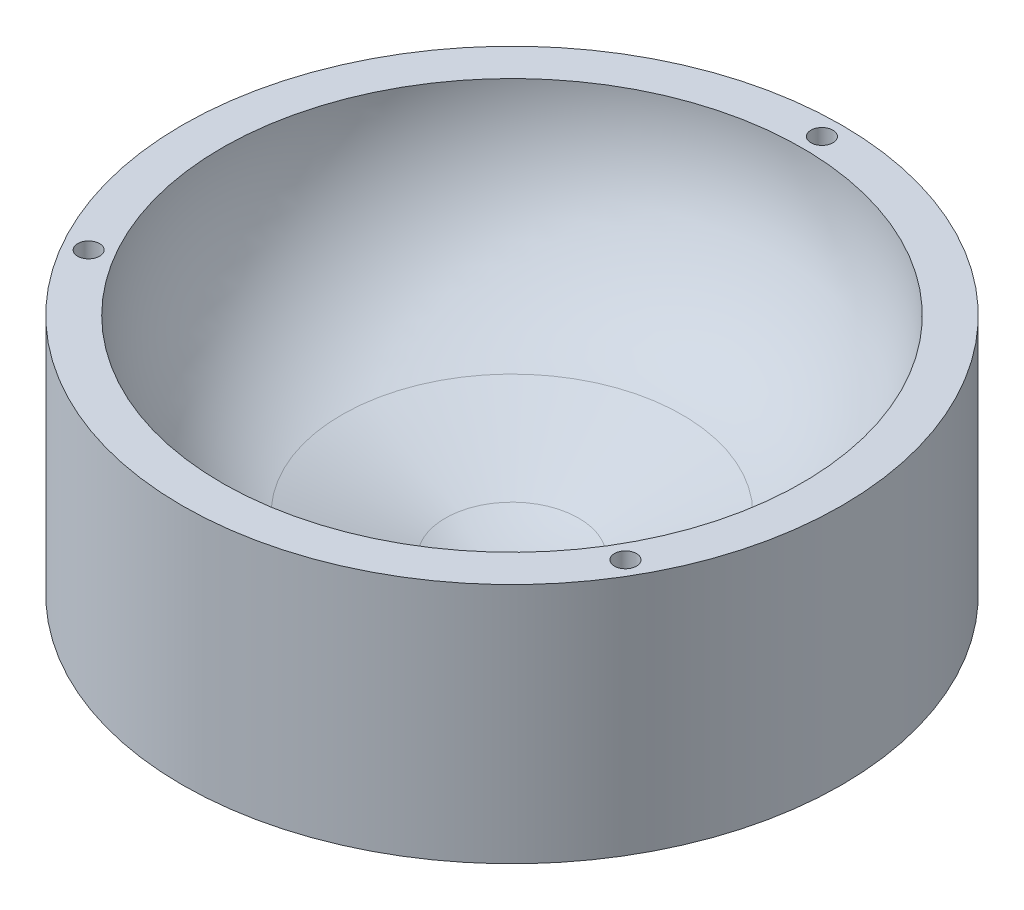
from build123d import *

# Parameters (mm, degrees)
SKETCH1_R           = 95.25
BOSS_EXTRUDE1_DEPTH = 34.925
SKETCH8_R           = 3.175
CUT_EXTRUDE1_DEPTH  = 69.85
CIRPATTERN1_COUNT   = 3
CUT_EXTRUDE2_START  = -34.925
SKETCH12_R          = 3.175
CUT_EXTRUDE2_DEPTH  = 63.5
CIRPATTERN2_COUNT   = 3


# Read off the part's stored shape, not the designer's step: Cavity1
with BuildPart() as part:
    # Sketch1 → Boss-Extrude1 (new, symmetric)
    with BuildSketch(Plane(origin=(0, 0, 0), x_dir=(1, 0, 0), z_dir=(0, 1, 0))):
        with Locations(Location((0, 0, 0), (0, 0, 270))):
            Circle(SKETCH1_R)
    extrude(amount=BOSS_EXTRUDE1_DEPTH, both=True)

    # Cavity1 outline → Cavity1 (revolve, cut)
    with BuildSketch(Plane.XY):
        with BuildLine():
            Line((0, 34.925), (0, -28.752211277))
            Line((0, -28.752211277), (0.381787731, -28.752211277))
            ThreePointArc((0.381787731, -28.752211277), (9.972417265, -27.913139917), (19.271640373, -25.421420595))
            Line((19.271640373, -25.421420595), (49.189756576, -14.532116831))
            ThreePointArc((49.189756576, -14.532116831), (74.301764107, 4.737004269), (83.820002599, 34.925))
            Line((83.820002599, 34.925), (0, 34.925))
        make_face()
    revolve(axis=Axis((0, 0, 0), (0, 1, 0)), mode=Mode.SUBTRACT)

    # Sketch8 → Cut-Extrude1 (cut)
    with BuildSketch(Plane(origin=(0, 34.925, 0), x_dir=(1, 0, 0), z_dir=(0, 1, 0))):
        with Locations(Location((0, 89.535, 0), (0, 0, 270))):
            Circle(SKETCH8_R)
    cut_extrude1 = extrude(amount=-CUT_EXTRUDE1_DEPTH, mode=Mode.SUBTRACT)

    # CirPattern1: Cut-Extrude1 ×3 about axis
    cirpattern1_axis = Axis((0, 0, 0), (0, 1, 0))
    for i in range(1, CIRPATTERN1_COUNT):
        add(cut_extrude1.rotate(cirpattern1_axis, i * 360 / CIRPATTERN1_COUNT), mode=Mode.SUBTRACT)

    # Sketch12 → Cut-Extrude2 (cut)
    with BuildSketch(Plane(origin=(0, 34.925, 0), x_dir=(1, 0, 0), z_dir=(0, 1, 0)).offset(CUT_EXTRUDE2_START)):
        with Locations(Location((77.539584528, 44.7675, 0), (0, 0, 270))):
            Circle(SKETCH12_R)
    cut_extrude2 = extrude(amount=-CUT_EXTRUDE2_DEPTH, mode=Mode.SUBTRACT)

    # CirPattern2: Cut-Extrude2 ×3 about axis
    cirpattern2_axis = Axis((0, 0, 0), (0, 1, 0))
    for i in range(1, CIRPATTERN2_COUNT):
        add(cut_extrude2.rotate(cirpattern2_axis, i * 360 / CIRPATTERN2_COUNT), mode=Mode.SUBTRACT)


solid = part.part
